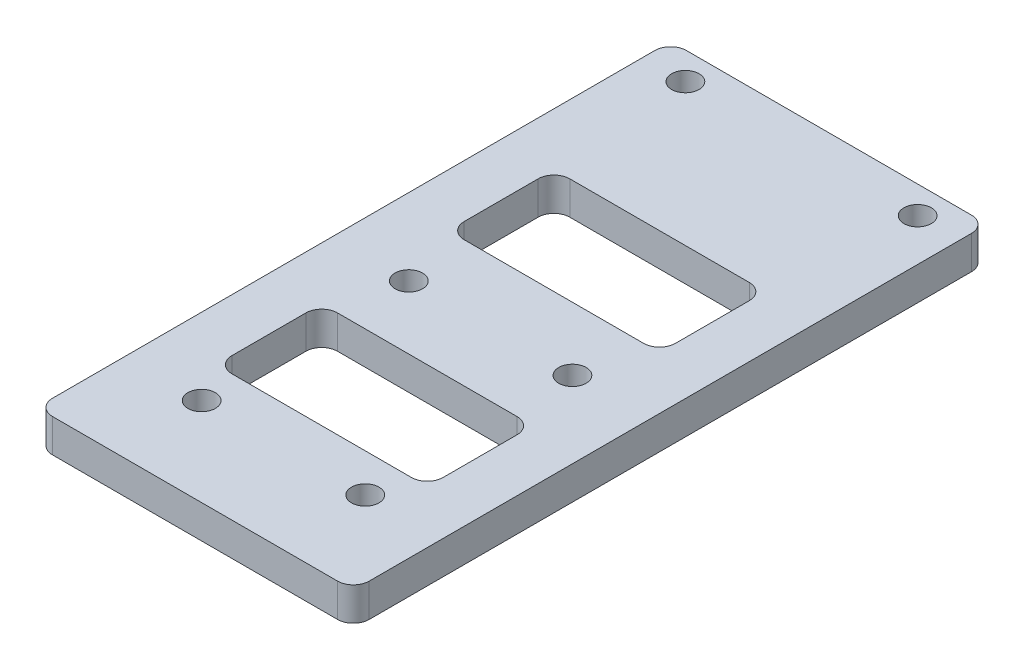
from build123d import *

# Parameters (mm, degrees)
SKETCH1_W           = 30
SKETCH1_H           = 60.05
BOSS_EXTRUDE1_DEPTH = 3.15
CUT_EXTRUDE1_DEPTH  = 34.710875471
SKETCH3_R           = 1.3
CUT_EXTRUDE2_DEPTH  = 34.710875471
FILLET1_R           = 1.5
SKETCH5_R           = 1.3
CUT_EXTRUDE3_DEPTH  = 34.710875471


with BuildPart() as part:
    # Sketch1 → Boss-Extrude1 (new body)
    with BuildSketch(Plane(origin=(0, 0, 0), x_dir=(1, 0, 0), z_dir=(0, 1, 0))):
        Rectangle(SKETCH1_W, SKETCH1_H)
    extrude(amount=-BOSS_EXTRUDE1_DEPTH)

    # Sketch2 → Cut-Extrude1 (cut, through all)
    with BuildSketch(Plane(origin=(0, 0, 0), x_dir=(1, 0, 0), z_dir=(0, 1, 0))):
        with BuildLine():
            Line((-8.5, 13.975), (8.5, 13.975))
            ThreePointArc((8.5, 13.975), (9.560660172, 13.535660172), (10, 12.475))
            Line((10, 12.475), (10, 5.475))
            ThreePointArc((10, 5.475), (9.560660172, 4.414339828), (8.5, 3.975))
            Line((8.5, 3.975), (-8.5, 3.975))
            ThreePointArc((-8.5, 3.975), (-9.560660172, 4.414339828), (-10, 5.475))
            Line((-10, 5.475), (-10, 12.475))
            ThreePointArc((-10, 12.475), (-9.560660172, 13.535660172), (-8.5, 13.975))
        make_face()
        with BuildLine():
            Line((-8.5, -8.025), (8.5, -8.025))
            ThreePointArc((8.5, -8.025), (9.560660172, -8.464339828), (10, -9.525))
            Line((10, -9.525), (10, -16.525))
            ThreePointArc((10, -16.525), (9.560660172, -17.585660172), (8.5, -18.025))
            Line((8.5, -18.025), (-8.5, -18.025))
            ThreePointArc((-8.5, -18.025), (-9.560660172, -17.585660172), (-10, -16.525))
            Line((-10, -16.525), (-10, -9.525))
            ThreePointArc((-10, -9.525), (-9.560660172, -8.464339828), (-8.5, -8.025))
        make_face()
    extrude(amount=-CUT_EXTRUDE1_DEPTH, mode=Mode.SUBTRACT)

    # Sketch3 → Cut-Extrude2 (cut, through all)
    with BuildSketch(Plane(origin=(0, 0, 0), x_dir=(1, 0, 0), z_dir=(0, 1, 0))):
        with Locations((-11, 27.425)):
            Circle(SKETCH3_R)
        with Locations((11, 27.425)):
            Circle(SKETCH3_R)
    extrude(amount=-CUT_EXTRUDE2_DEPTH, mode=Mode.SUBTRACT)

    # Fillet1
    fillet1_edges = [part.edges().sort_by_distance(p)[0] for p in [
        (15, -1.575, -30.025),
        (-15, -1.575, -30.025),
        (15, -1.575, 30.025),
        (-15, -1.575, 30.025),
    ]]
    fillet(fillet1_edges, radius=FILLET1_R)

    # Sketch5 → Cut-Extrude3 (cut, through all)
    with BuildSketch(Plane(origin=(0, 0, 0), x_dir=(1, 0, 0), z_dir=(0, 1, 0))):
        with Locations((-7.75, -2.025)):
            Circle(SKETCH5_R)
        with Locations((7.75, -2.025)):
            Circle(SKETCH5_R)
        with Locations((-7.75, -21.65)):
            Circle(SKETCH5_R)
        with Locations((7.75, -21.65)):
            Circle(SKETCH5_R)
    extrude(amount=-CUT_EXTRUDE3_DEPTH, mode=Mode.SUBTRACT)


solid = part.part
